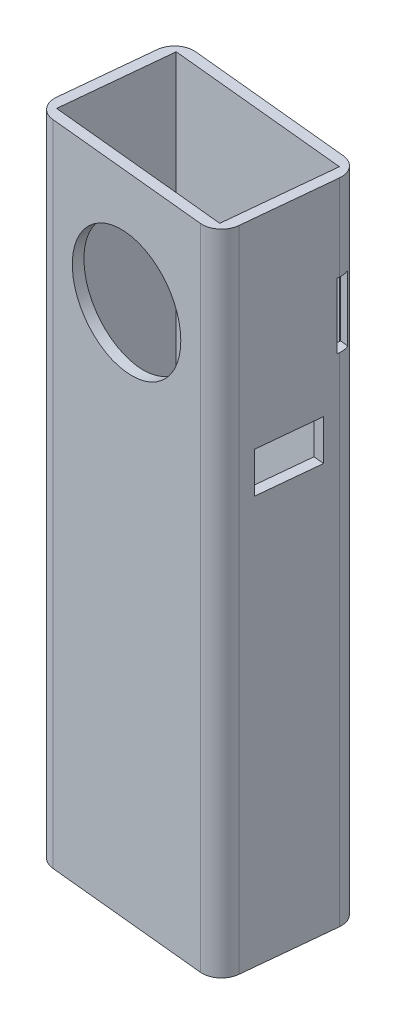
from build123d import *
from build123d.topology import SkipClean

# Parameters (mm, degrees)
BOSS_EXTRUDE1_DEPTH = 130
SHELL1_T            = -2.2
SKETCH3_W           = 13
SKETCH3_H           = 8.4
CUT_EXTRUDE1_DEPTH  = 2.2
SKETCH6_W           = 2.478928052
SKETCH6_H           = 13.527023683
CUT_EXTRUDE2_DEPTH  = 2.2
SKETCH4_R           = 12.5
CUT_EXTRUDE3_DEPTH  = 2.2
FILLET1_R           = 4
SKETCH7_W           = 22.6
SKETCH7_H           = 50.325296996
BOSS_EXTRUDE2_DEPTH = 3
SKETCH8_W           = 22.6
SKETCH8_H           = 23.572157484
CUT_EXTRUDE4_DEPTH  = 3
CHAMFER1_SIZE       = 10
CHAMFER1_SIZE_2     = 5.543090515
BOSS_EXTRUDE3_START = 4
BOSS_EXTRUDE3_DEPTH = 4
CUT_EXTRUDE5_DEPTH  = 5


with BuildPart() as part:
    # Sketch1 → Boss-Extrude1 (new body)
    with BuildSketch(Plane(origin=(0, 0, 0), x_dir=(1, 0, 0), z_dir=(0, 1, 0))):
        Polygon((0, 0), (41.795955874, -4.134981567), (44.45415831, 22.733847209), (2.658202436, 26.868828776), align=None)
    extrude(amount=BOSS_EXTRUDE1_DEPTH)

    # Shell1
    shell1_openings = [part.faces().sort_by_distance(p)[0] for p in [
        (22.227079155, 130, -11.366923605),
    ]]
    offset(amount=SHELL1_T, openings=shell1_openings, kind=Kind.INTERSECTION)

    # Sketch3 → Cut-Extrude1 (cut)
    with BuildSketch(Plane(origin=(41.795955874, 0, 4.134981567), x_dir=(0.09845194207530276, 0, -0.9951418065288994), z_dir=(0.9951418065288994, 0, 0.09845194207530276))):
        with Locations((13.5, 84.444630111)):
            Rectangle(SKETCH3_W, SKETCH3_H)
    extrude(amount=-CUT_EXTRUDE1_DEPTH, mode=Mode.SUBTRACT)

    # Sketch6 → Cut-Extrude2 (cut)
    with BuildSketch(Plane(origin=(41.795955874, 0, 4.134981567), x_dir=(0.09845194207530188, 0, -0.9951418065288994), z_dir=(0.9951418065288995, 0, 0.09845194207530189))):
        with Locations((23.779140081, 105.491766173)):
            Rectangle(SKETCH6_W, SKETCH6_H)
    extrude(amount=-CUT_EXTRUDE2_DEPTH, mode=Mode.SUBTRACT)

    # Sketch4 → Cut-Extrude3 (cut)
    with BuildSketch(Plane(origin=(0, 0, 0), x_dir=(0.9951418065288994, 0, 0.0984519420753021), z_dir=(-0.09845194207530208, 0, 0.9951418065288993))):
        with Locations((21, 106.537728643)):
            Circle(SKETCH4_R)
    extrude(amount=-CUT_EXTRUDE3_DEPTH, mode=Mode.SUBTRACT)

    # Fillet1
    # the kernel refuses this fillet: 4 mm, written as the material it takes off along each edge
    with BuildSketch(Plane(origin=(2.658202436, -10, -26.868828776), x_dir=(-0.0984519420753019, 0, 0.9951418065288995), z_dir=(0, 1, 0)), Plane(origin=(0, -10, 0), x_dir=(0.9951418065288994, 0, 0.09845194207530183), z_dir=(0, 1, 0))) as fillet1_piece_1:
        with BuildLine():
            CenterArc((FILLET1_R, FILLET1_R), FILLET1_R, 180, 90)
            Line((0, FILLET1_R), (0, 0))
            Line((0, 0), (FILLET1_R, 0))
        make_face()
    extrude(amount=150, mode=Mode.SUBTRACT)
    with BuildSketch(Plane(origin=(44.45415831, -10, -22.733847209), x_dir=(-0.09845194207530218, 0, 0.9951418065288994), z_dir=(0, 1, 0)), Plane(origin=(41.795955874, -10, 4.134981567), x_dir=(-0.9951418065288994, 0, -0.09845194207530182), z_dir=(0, 1, 0))) as fillet1_piece_2:
        with BuildLine():
            CenterArc((FILLET1_R, -FILLET1_R), FILLET1_R, 90, 90)
            Line((0, -FILLET1_R), (0, 0))
            Line((0, 0), (FILLET1_R, 0))
        make_face()
    extrude(amount=150, mode=Mode.SUBTRACT)

    # Sketch7 → Boss-Extrude2 (add)
    with BuildSketch(Plane(origin=(39.6066439, 0, 3.918387295), x_dir=(-0.09845194207530197, 0, 0.9951418065288994), z_dir=(-0.9951418065288995, 0, -0.09845194207530199))):
        with Locations((-13.5, 27.362648498)):
            Rectangle(SKETCH7_W, SKETCH7_H)
    extrude(amount=BOSS_EXTRUDE2_DEPTH)

    # Sketch8 → Cut-Extrude4 (cut)
    with BuildSketch(Plane(origin=(36.62121848, 0, 3.623031468), x_dir=(-0.09845194207530192, 0, 0.9951418065288994), z_dir=(-0.9951418065288995, 0, -0.09845194207530193))):
        with Locations((-13.5, 24.971356382)):
            Rectangle(SKETCH8_W, SKETCH8_H)
    extrude(amount=-CUT_EXTRUDE4_DEPTH, mode=Mode.SUBTRACT)

    # Chamfer1
    # the kernel refuses this chamfer: 10, 5.543090515 mm, written as the material it takes off along each edge
    with BuildSketch(Plane(origin=(36.837812753, 36.757435124, 1.433719494), x_dir=(-0.018642579535210594, 0.9998245108869491, -0.0018443584105231356), z_dir=(0.09845194207530193, 0, -0.9951418065288995))) as chamfer1_piece_1_section:
        Polygon((CHAMFER1_SIZE * 0.999824510887, CHAMFER1_SIZE * 0.0187335909444), (-CHAMFER1_SIZE_2 * 0.0187335909428, CHAMFER1_SIZE_2 * 0.999824510802), (0, 0), align=None)
    chamfer1_piece_1 = extrude(amount=22.6, mode=Mode.PRIVATE)
    chamfer1_piece_1 = split(chamfer1_piece_1, bisect_by=Plane(origin=(40.104235357, 40.578335675, -1.111214466), z_dir=(-0.9951418065288995, 0, -0.09845194207530193)), keep=Keep.TOP, mode=Mode.PRIVATE)
    add(chamfer1_piece_1, mode=Mode.SUBTRACT)

    # Sketch9 → Boss-Extrude3 (add)
    with BuildSketch(Plane.XZ.offset(BOSS_EXTRUDE3_START)):
        with BuildLine():
            Line((6.638769662, -26.475021008), (40.473591084, -23.127654977))
            ThreePointArc((40.473591084, -23.127654977), (43.172933538, -21.683309686), (44.060350542, -18.753279983))
            Line((44.060350542, -18.753279983), (42.189763643, 0.154414341))
            ThreePointArc((42.189763643, 0.154414341), (40.745418352, 2.853756795), (37.815388648, 3.741173799))
            Line((37.815388648, 3.741173799), (3.980567226, 0.393807768))
            ThreePointArc((3.980567226, 0.393807768), (1.281224772, -1.050537523), (0.393807768, -3.980567226))
            Line((0.393807768, -3.980567226), (2.264394668, -22.88826155))
            ThreePointArc((2.264394668, -22.88826155), (3.708739959, -25.587604004), (6.638769662, -26.475021008))
        make_face()
    extrude(amount=-BOSS_EXTRUDE3_DEPTH)

    # Sketch11 → Cut-Extrude5 (cut)
    with SkipClean():  # the faces are left unmerged after this step: merging them gives an invalid solid
        with BuildSketch(Plane.XZ.offset(4)):
            Polygon((26.115143368, -16.562744329), (28.84792956, -10.702265428), (25.13899905, -5.405363713), (21.794217599, -5.697994172), (18.449436148, -5.990624631), (15.716649956, -11.851103531), (19.425580466, -17.148005247), (22.770361917, -16.855374788), align=None)
        extrude(amount=-CUT_EXTRUDE5_DEPTH, mode=Mode.SUBTRACT)


solid = part.part
